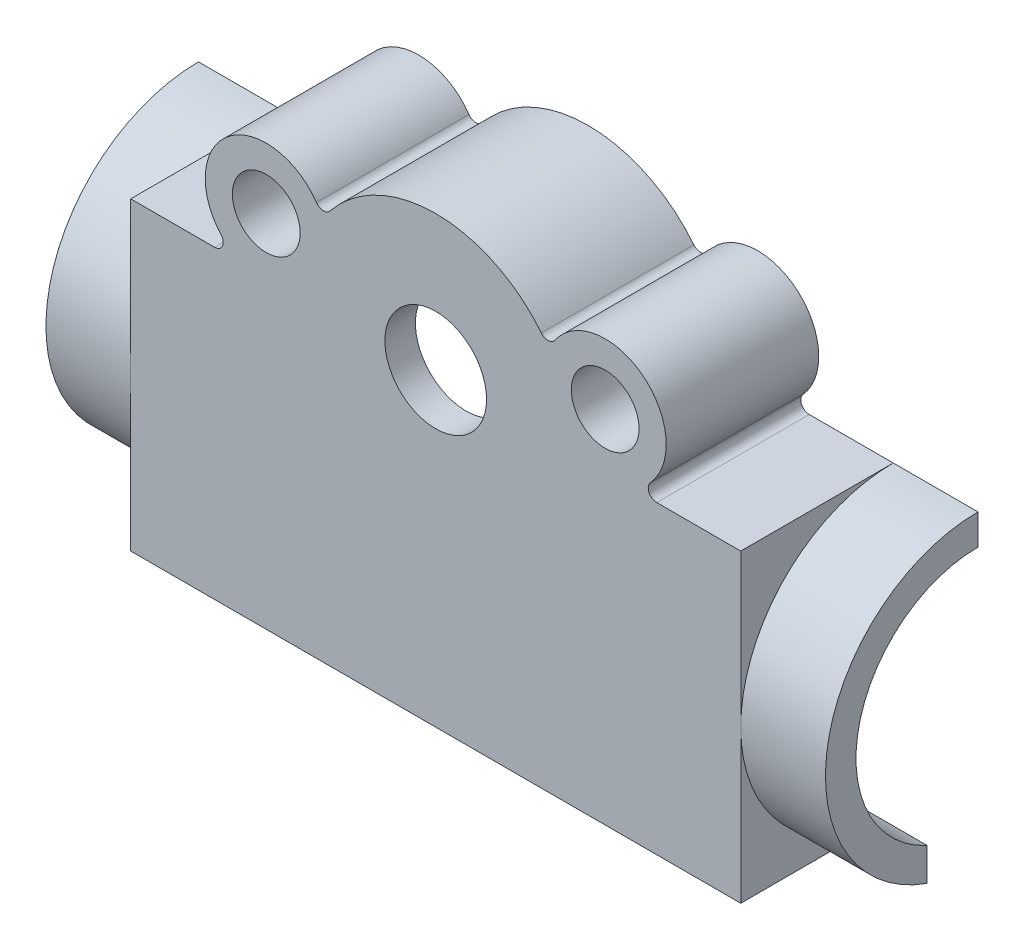
from build123d import *
from build123d.topology import SkipClean

# Parameters (mm, degrees)
BOSS_EXTRUDE1_DEPTH = 18
SKETCH4_R           = 9
SKETCH4_R_2         = 7.2
BOSS_EXTRUDE2_DEPTH = 5
SPLIT2_START        = -23
SPLIT2_DEPTH        = 5
SPLIT2_START_2      = 18
SPLIT2_2_DEPTH      = 5
SPLIT2_3_DEPTH      = 5
SPLIT2_4_DEPTH      = 5
SHELL1_T            = -1.8
BOSS_EXTRUDE6_DEPTH = 3
SKETCH10_W          = 8
SKETCH10_H          = 3
CUT_EXTRUDE2_DEPTH  = 5
SKETCH11_W          = 3
SKETCH11_H          = 2
BOSS_EXTRUDE5_DEPTH = 3
SKETCH12_R          = 3
CUT_EXTRUDE3_DEPTH  = 10
SKETCH14_R          = 3.6
SKETCH14_R_2        = 1.2
BOSS_EXTRUDE7_DEPTH = 9
SKETCH14_3_R        = 2
SKETCH14_3_R_2      = 1.2
CUT_EXTRUDE4_DEPTH  = 3
FILLET1_R           = 0.5


# Read off the part's stored shape, not the designer's step: Split2
with BuildPart() as part:
    # Sketch1 → Boss-Extrude1 (new body)
    with BuildSketch(Plane.XY):
        with BuildLine():
            Line((-18, -18.25), (18, -18.25))
            Line((18, -18.25), (18, -0.25))
            Line((18, -0.25), (12.10113631, -0.25))
            Line((12.10113631, -0.25), (7.996092796, -0.25))
            ThreePointArc((7.996092796, -0.25), (0, -8), (-7.996092796, -0.25))
            Line((-7.996092796, -0.25), (-12.10113631, -0.25))
            Line((-12.10113631, -0.25), (-18, -0.25))
            Line((-18, -0.25), (-18, -18.25))
        make_face()
        with BuildLine():
            ThreePointArc((-7.996092796, -0.25), (0, -8), (7.996092796, -0.25))
            Line((7.996092796, -0.25), (-7.996092796, -0.25))
        make_face()
        with BuildLine():
            Line((-7.996092796, -0.25), (7.996092796, -0.25))
            ThreePointArc((7.996092796, -0.25), (7.999023139, -0.125015265), (8, 0))
            ThreePointArc((8, 0), (7.86049696, 1.487476905), (7.446853114, 2.923076923))
            ThreePointArc((7.446853114, 2.923076923), (0, 8), (-7.446853114, 2.923076923))
            ThreePointArc((-7.446853114, 2.923076923), (-7.882781799, 1.364460009), (-7.996092796, -0.25))
        make_face()
        with BuildLine():
            Line((7.996092796, -0.25), (12.10113631, -0.25))
            ThreePointArc((12.10113631, -0.25), (9.28463275, 0.618740181), (7.446853114, 2.923076923))
            ThreePointArc((7.446853114, 2.923076923), (7.86049696, 1.487476905), (8, 0))
            ThreePointArc((8, 0), (7.999023139, -0.125015265), (7.996092796, -0.25))
        make_face()
        with BuildLine():
            ThreePointArc((-7.446853114, 2.923076923), (-9.28463275, 0.618740181), (-12.10113631, -0.25))
            Line((-12.10113631, -0.25), (-7.996092796, -0.25))
            ThreePointArc((-7.996092796, -0.25), (-7.882781799, 1.364460009), (-7.446853114, 2.923076923))
        make_face()
    extrude(amount=BOSS_EXTRUDE1_DEPTH)

    # Sketch4 → Boss-Extrude2 (add)
    with BuildSketch(Plane(origin=(18, 0, 0), x_dir=(0, 0, -1), z_dir=(1, 0, 0))):
        with Locations((-9, -9.25)):
            Circle(SKETCH4_R)
        with Locations((-9, -9.25)):
            Circle(SKETCH4_R_2, mode=Mode.SUBTRACT)
    boss_extrude2 = extrude(amount=BOSS_EXTRUDE2_DEPTH)

    # Mirror1: Boss-Extrude2 across plane
    add(boss_extrude2.mirror(Plane(origin=(0, 0, 0), x_dir=(0, 0, 1), z_dir=(1, 0, 0))))


with BuildPart() as body_2:
    # Split1: the piece on the far side of the plane
    add(part.part)
    split(bisect_by=Plane.XY.offset(9), keep=Keep.BOTTOM)


with BuildPart() as part_1:
    add(part.part)

    # Split1
    split(bisect_by=Plane.XY.offset(9), keep=Keep.TOP)

    # Split2 3 outline → Split2 3 (cut)
    with BuildSketch(Plane.YZ.offset(SPLIT2_START)):
        with BuildLine():
            Line((-18.25, 9), (-16.45, 9))
            ThreePointArc((-16.45, 9), (-9.25, 16.2), (-2.05, 9))
            Line((-2.05, 9), (-0.25, 9))
            ThreePointArc((-0.25, 9), (-9.25, 18), (-18.25, 9))
        make_face()
    extrude(amount=SPLIT2_3_DEPTH, mode=Mode.SUBTRACT)

    # Split2 4 outline → Split2 4 (cut)
    with BuildSketch(Plane.YZ.offset(SPLIT2_START_2)):
        with BuildLine():
            Line((-18.25, 9), (-16.45, 9))
            ThreePointArc((-16.45, 9), (-9.25, 16.2), (-2.05, 9))
            Line((-2.05, 9), (-0.25, 9))
            ThreePointArc((-0.25, 9), (-9.25, 18), (-18.25, 9))
        make_face()
    extrude(amount=SPLIT2_4_DEPTH, mode=Mode.SUBTRACT)

    # Shell1
    shell1_openings = [part_1.faces().sort_by_distance(p)[0] for p in [
        (18, -9.25, 13.5),
        (-18, -9.25, 13.5),
        (0, -7.45255142, 9),
    ]]
    offset(amount=SHELL1_T, openings=shell1_openings, kind=Kind.INTERSECTION)



with BuildPart() as body_2_2:
    # Split2 outline → Split2 (new body)
    with BuildSketch(Plane.YZ.offset(SPLIT2_START)):
        with BuildLine():
            Line((-2.05, 9), (-0.25, 9))
            ThreePointArc((-0.25, 9), (-9.25, 18), (-18.25, 9))
            Line((-18.25, 9), (-16.45, 9))
            ThreePointArc((-16.45, 9), (-9.25, 16.2), (-2.05, 9))
        make_face()
    extrude(amount=SPLIT2_DEPTH)


with BuildPart() as body_3:
    # Split2 2 outline → Split2 2 (new body)
    with BuildSketch(Plane.YZ.offset(SPLIT2_START_2)):
        with BuildLine():
            Line((-18.25, 9), (-16.45, 9))
            ThreePointArc((-16.45, 9), (-9.25, 16.2), (-2.05, 9))
            Line((-2.05, 9), (-0.25, 9))
            ThreePointArc((-0.25, 9), (-9.25, 18), (-18.25, 9))
        make_face()
    extrude(amount=SPLIT2_2_DEPTH)


with BuildPart() as part_2:
    with SkipClean():  # the faces are left unmerged after this step: merging them gives an invalid solid
        add(part_1.part)

        add(body_3.part)  # Boss-Extrude6 merges body 3
        # Sketch13 → Boss-Extrude6 (add)
        with BuildSketch(Plane(origin=(18, 0, 0), x_dir=(0, 0, -1), z_dir=(1, 0, 0))):
            with BuildLine():
                ThreePointArc((-16.2, -3.85), (-15.363961031, -2.886038969), (-14.4, -2.05))
                Line((-14.4, -2.05), (-16.2, -2.05))
                Line((-16.2, -2.05), (-16.2, -3.85))
            make_face()
            with BuildLine():
                ThreePointArc((-16.2, -9.25), (-14.091168825, -4.158831175), (-9, -2.05))
                Line((-9, -2.05), (-14.4, -2.05))
                ThreePointArc((-14.4, -2.05), (-15.363961031, -2.886038969), (-16.2, -3.85))
                Line((-16.2, -3.85), (-16.2, -9.25))
            make_face()
            with BuildLine():
                Line((-14.4, -16.45), (-9, -16.45))
                ThreePointArc((-9, -16.45), (-14.091168825, -14.341168825), (-16.2, -9.25))
                Line((-16.2, -9.25), (-16.2, -14.65))
                ThreePointArc((-16.2, -14.65), (-15.363961031, -15.613961031), (-14.4, -16.45))
            make_face()
            with BuildLine():
                ThreePointArc((-14.4, -16.45), (-15.363961031, -15.613961031), (-16.2, -14.65))
                Line((-16.2, -14.65), (-16.2, -16.45))
                Line((-16.2, -16.45), (-14.4, -16.45))
            make_face()
        boss_extrude6 = extrude(amount=-BOSS_EXTRUDE6_DEPTH)

    # Mirror2: Boss-Extrude6 across plane
    with SkipClean():  # the faces are left unmerged after this step: merging them gives an invalid solid
        add(boss_extrude6.mirror(Plane(origin=(0, 0, 0), x_dir=(0, 0, 1), z_dir=(1, 0, 0))))


with BuildPart() as cut_extrude2_tool:
    # Sketch10 → Cut-Extrude2 (new body)
    with SkipClean():  # the faces are left unmerged after this step: merging them gives an invalid solid
        with BuildSketch(Plane.XZ.offset(18.25)):
            with Locations((-19, 10.5)):
                Rectangle(SKETCH10_W, SKETCH10_H)
            with Locations((19, 10.5)):
                Rectangle(SKETCH10_W, SKETCH10_H)
        extrude(amount=-CUT_EXTRUDE2_DEPTH)


with BuildPart() as part_3:
    with SkipClean():  # the faces are left unmerged after this step: merging them gives an invalid solid
        add(part_2.part)

        # Cut-Extrude2: cut by cut_extrude2_tool
        add(cut_extrude2_tool.part, mode=Mode.SUBTRACT)

    # Sketch11 → Boss-Extrude5 (add)
    with SkipClean():  # the faces are left unmerged after this step: merging them gives an invalid solid
        with BuildSketch(Plane(origin=(0, 0, 9), x_dir=(-1, 0, 0), z_dir=(0, 0, -1))):
            with Locations((4.3, -15.45)):
                Rectangle(SKETCH11_W, SKETCH11_H)
        boss_extrude5 = extrude(amount=-BOSS_EXTRUDE5_DEPTH)

    # Mirror8: Boss-Extrude5 across plane
    with SkipClean():  # the faces are left unmerged after this step: merging them gives an invalid solid
        add(boss_extrude5.mirror(Plane(origin=(0, 0, 0), x_dir=(0, 0, 1), z_dir=(1, 0, 0))))

    # Sketch12 → Cut-Extrude3 (cut)
    # profile 1 of 2: a face of its own
    with SkipClean():  # the faces are left unmerged after this step: merging them gives an invalid solid
        with BuildSketch(Plane.XY.offset(18)):
            Circle(SKETCH12_R)
            Polygon((2, 0), (1, 1.732050808), (-1, 1.732050808), (-2, 0), (-1, -1.732050808), (1, -1.732050808), align=None, mode=Mode.SUBTRACT)
        # profile 2 of 2: a face of its own
        with BuildSketch(Plane.XY.offset(18)):
            Polygon((1, -1.732050808), (2, 0), (1, 1.732050808), (-1, 1.732050808), (-2, 0), (-1, -1.732050808), align=None)
        extrude(amount=-CUT_EXTRUDE3_DEPTH, mode=Mode.SUBTRACT)

    # Sketch14 → Boss-Extrude7 (add)
    with SkipClean():  # the faces are left unmerged after this step: merging them gives an invalid solid
        with BuildSketch(Plane.XY.offset(18)):
            with Locations((-10, 3)):
                Circle(SKETCH14_R)
            with Locations((-10, 3)):
                Circle(SKETCH14_R_2, mode=Mode.SUBTRACT)
        boss_extrude7 = extrude(amount=-BOSS_EXTRUDE7_DEPTH)

    # Sketch14<3> → Cut-Extrude4 (cut)
    with SkipClean():  # the faces are left unmerged after this step: merging them gives an invalid solid
        with BuildSketch(Plane.XY.offset(18)):
            with Locations((-10, 3)):
                Circle(SKETCH14_3_R)
            with Locations((-10, 3)):
                Circle(SKETCH14_3_R_2, mode=Mode.SUBTRACT)
        cut_extrude4 = extrude(amount=-CUT_EXTRUDE4_DEPTH, mode=Mode.SUBTRACT)

    # Mirror9: Boss-Extrude7, Cut-Extrude4 across plane
    with SkipClean():  # the faces are left unmerged after this step: merging them gives an invalid solid
        add(boss_extrude7.mirror(Plane(origin=(0, 0, 0), x_dir=(0, 0, 1), z_dir=(1, 0, 0))))
        add(cut_extrude4.mirror(Plane(origin=(0, 0, 0), x_dir=(0, 0, 1), z_dir=(1, 0, 0))), mode=Mode.SUBTRACT)

    # Fillet1
    # the kernel refuses this fillet: 0.5 mm, written as the material it adds along each edge
    with BuildSketch(Plane(origin=(-11.600134445, -0.224836392, 18), x_dir=(-0.9998475289118255, -0.017461927983941913, 0), z_dir=(0, 0, -1))) as fillet1_piece_1:
        with BuildLine():
            CenterArc((1.43232455, 0.499923764), FILLET1_R, 138.876982159, 132.123563468)
            Line((1.05567493, 0.828762728), (1.018009968, 0.861646624))
            ThreePointArc((1.018009968, 0.861646624), (0.535925496, 0.40407886), (-0.02300281, 0.04439449))
            Line((-0.02300281, 0.04439449), (-0.004140552, -0.049828263))
            ThreePointArc((-0.004140552, -0.049828263), (0.502237978, -0.066403689), (1.441928611, -0.049992376))
            Line((1.441928611, -0.049992376), (1.441055514, 0))
        make_face()
    extrude(amount=9)
    with BuildSketch(Plane(origin=(-6.682571593, 4.398094691, 18), x_dir=(0.5888742220615208, 0.8082246906593726, 0), z_dir=(0, 0, -1))) as fillet1_piece_2:
        with BuildLine():
            CenterArc((0.784874944, -0.499433997), FILLET1_R, 92.72648474, 106.623608355)
            ThreePointArc((0.313119131, -0.665103707), (0.173580894, -0.324538512), (0, 0))
            ThreePointArc((0, 0), (0.380545427, -0.009056052), (0.761090855, 0))
        make_face()
    extrude(amount=9)
    with BuildSketch(Plane(origin=(11.600134445, -0.224836392, 18), x_dir=(0.9998475289118255, -0.01746192798394126, 0), z_dir=(0, 0, -1))) as fillet1_piece_3:
        with BuildLine():
            CenterArc((1.43232455, -0.499923764), FILLET1_R, 88.999454372, 132.123563468)
            Line((1.05567493, -0.828762728), (1.018009968, -0.861646624))
            ThreePointArc((1.018009968, -0.861646624), (0.535925496, -0.40407886), (-0.02300281, -0.04439449))
            Line((-0.02300281, -0.04439449), (-0.004140552, 0.049828263))
            ThreePointArc((-0.004140552, 0.049828263), (0.502237978, 0.066403689), (1.441928611, 0.049992376))
            Line((1.441928611, 0.049992376), (1.441055514, 0))
        make_face()
    extrude(amount=9)
    with BuildSketch(Plane(origin=(6.682571593, 4.39809469, 18), x_dir=(-0.5888742220569161, 0.8082246906627277, 0), z_dir=(0, 0, -1))) as fillet1_piece_4:
        with BuildLine():
            CenterArc((0.784874944, 0.499433997), FILLET1_R, 160.649906904, 106.623608356)
            ThreePointArc((0.313119131, 0.665103707), (0.173580894, 0.324538512), (0, 0))
            ThreePointArc((0, 0), (0.380545427, 0.009056052), (0.761090855, 0))
        make_face()
    extrude(amount=9)


with BuildPart() as body_2_2_1:
    with SkipClean():  # the faces are left unmerged after this step: merging them gives an invalid solid
        add(body_2_2.part)

        # Cut-Extrude2: cut by cut_extrude2_tool
        add(cut_extrude2_tool.part, mode=Mode.SUBTRACT)


solid = Compound([part_3.part, body_2_2_1.part])
